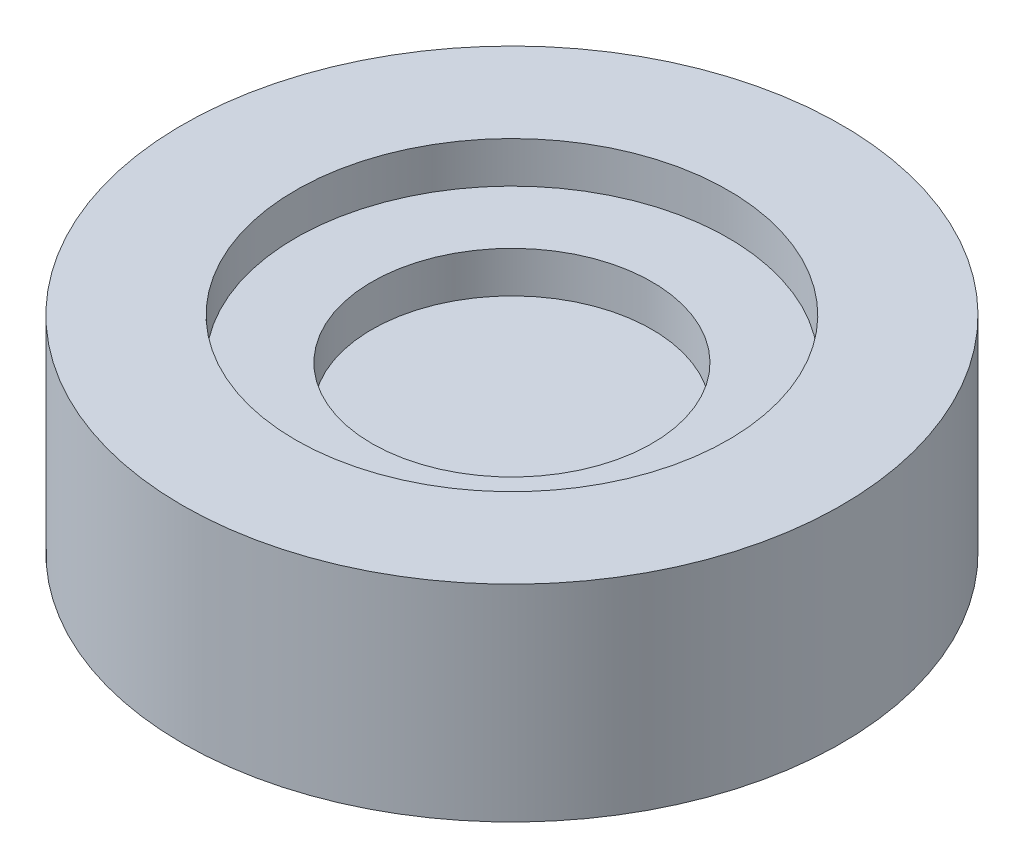
from build123d import *

# Parameters (mm, degrees)
SKETCH1_R           = 8
BOSS_EXTRUDE1_DEPTH = 5
SKETCH2_W           = 6.4
SKETCH2_H           = 3.2
CUT_EXTRUDE1_DEPTH  = 2


with BuildPart() as part:
    # Sketch1 → Boss-Extrude1 (new body)
    with BuildSketch(Plane(origin=(0, 0, 0), x_dir=(1, 0, 0), z_dir=(0, 1, 0))):
        Circle(SKETCH1_R)
    extrude(amount=BOSS_EXTRUDE1_DEPTH)

    # Sketch2 → Cut-Extrude1 (cut)
    with BuildSketch(Plane.XZ):
        Rectangle(SKETCH2_W, SKETCH2_H)
    extrude(amount=-CUT_EXTRUDE1_DEPTH, mode=Mode.SUBTRACT)

    # Sketch3 → Cut-Revolve1 (revolve, cut)
    with BuildSketch(Plane.XY):
        Polygon((0, 3), (-3.4, 3), (-3.4, 4), (-5.25, 4), (-5.25, 5), (0, 5), align=None)
    revolve(axis=Axis((0, 0, 0), (0, -1, 0)), mode=Mode.SUBTRACT)


solid = part.part
